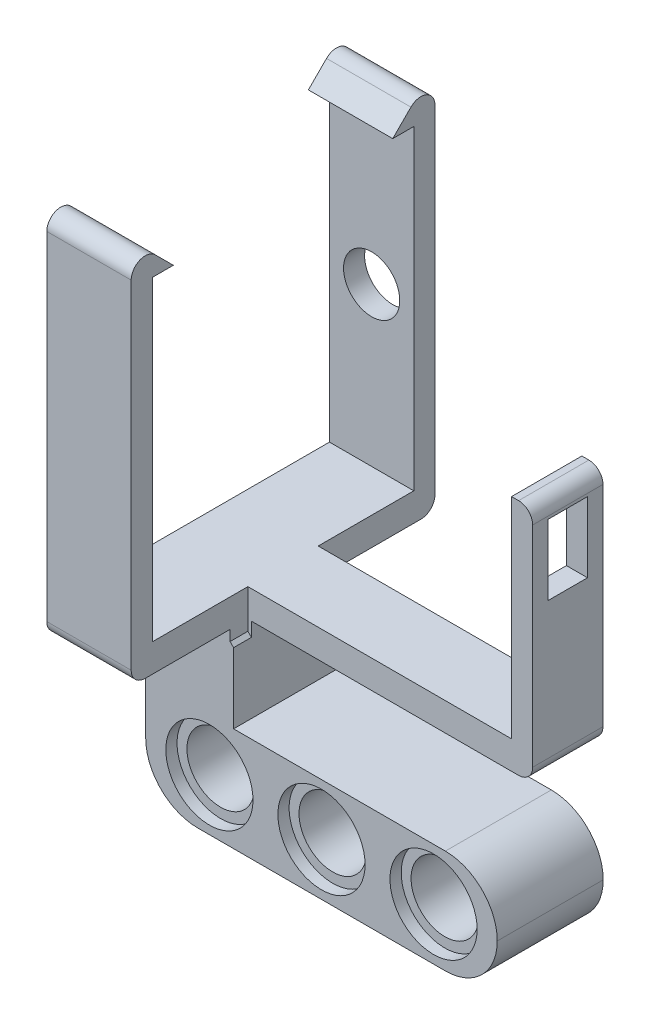
from build123d import *

# Parameters (mm, degrees)
SKETCH1_W           = 37
SKETCH1_H           = 21.6
BOSS_EXTRUDE1_DEPTH = 2
SKETCH2_W           = 6
SKETCH2_H           = 1.5
SKETCH2_W_2         = 1.5
SKETCH2_H_2         = 5
BOSS_EXTRUDE2_DEPTH = 22.44
SKETCH3_W           = 6
SKETCH3_H           = 3
BOSS_EXTRUDE3_DEPTH = 5
CHAMFER1_SIZE       = 5
SKETCH4_W           = 6
SKETCH4_H           = 3
BOSS_EXTRUDE4_DEPTH = 5
CHAMFER2_SIZE       = 5
SKETCH6_W           = 5
SKETCH6_H           = 7.52
SKETCH6_W_2         = 2.8
SKETCH6_H_2         = 5
CUT_EXTRUDE1_DEPTH  = 5
SKETCH8_W           = 20.25
SKETCH8_H           = 8.3
SKETCH8_W_2         = 10.75
SKETCH8_H_2         = 21.6
CUT_EXTRUDE3_DEPTH  = 10
FILLET1_R           = 1
FILLET2_R           = 1
SKETCH9_R           = 2
CUT_EXTRUDE4_DEPTH  = 10
SKETCH13_W          = 25
SKETCH13_H          = 7.533980582
BOSS_EXTRUDE5_DEPTH = 13.38
SKETCH14_R          = 2.4
CUT_EXTRUDE5_DEPTH  = 7.92
SKETCH15_R          = 3.1
SKETCH15_W          = 0.016515358
SKETCH15_H          = 0.077878544
CUT_EXTRUDE6_DEPTH  = 0.8
CUT_EXTRUDE7_START  = -0.8
SKETCH16_R          = 3.1
CUT_EXTRUDE7_DEPTH  = 0.8
SKETCH19_W          = 18.75
SKETCH19_H          = 6
CUT_EXTRUDE8_DEPTH  = 10
FILLET3_R           = 3.69
CHAMFER3_SIZE       = 1
CHAMFER4_SIZE       = 1


# Some blends are built 0.0001 mm under size
with BuildPart() as part:
    # Sketch1 → Boss-Extrude1 (new body)
    with BuildSketch(Plane(origin=(0, 0, 0), x_dir=(1, 0, 0), z_dir=(0, 1, 0))):
        Rectangle(SKETCH1_W, SKETCH1_H)
    extrude(amount=BOSS_EXTRUDE1_DEPTH)

    # Sketch2 → Boss-Extrude2 (add)
    with BuildSketch(Plane(origin=(0, 2, 0), x_dir=(1, 0, 0), z_dir=(0, 1, 0))):
        with Locations((-4.75, 10.05)):
            Rectangle(SKETCH2_W, SKETCH2_H)
        with Locations((-4.75, -10.05)):
            Rectangle(SKETCH2_W, SKETCH2_H)
        with Locations((17.75, 0)):
            Rectangle(SKETCH2_W_2, SKETCH2_H_2)
    extrude(amount=BOSS_EXTRUDE2_DEPTH)

    # Sketch3 → Boss-Extrude3 (add)
    with BuildSketch(Plane(origin=(0, 24.44, 0), x_dir=(1, 0, 0), z_dir=(0, 1, 0))):
        with Locations((-4.75, 9.3)):
            Rectangle(SKETCH3_W, SKETCH3_H)
    extrude(amount=BOSS_EXTRUDE3_DEPTH)

    # Chamfer1
    # the kernel refuses this chamfer: 5 mm, written as the material it takes off along each edge
    with BuildSketch(Plane(origin=(11.10841494, 29.44, -7.8), x_dir=(0, -0.9996219169112968, 0.027495876610586317), z_dir=(-1, 0, 0))) as chamfer1_piece_1:
        Polygon((CHAMFER1_SIZE * 0.999621916911, -CHAMFER1_SIZE * 0.0274958766106), (-CHAMFER1_SIZE * 0.0274958766106, -CHAMFER1_SIZE * 0.999621916911), (0, 0), align=None)
    extrude(amount=31.71682988, mode=Mode.SUBTRACT)

    # Sketch4 → Boss-Extrude4 (add)
    with BuildSketch(Plane(origin=(0, 24.44, 0), x_dir=(1, 0, 0), z_dir=(0, 1, 0))):
        with Locations((-4.75, -9.3)):
            Rectangle(SKETCH4_W, SKETCH4_H)
    extrude(amount=BOSS_EXTRUDE4_DEPTH)

    # Chamfer2
    # the kernel refuses this chamfer: 5 mm, written as the material it takes off along each edge
    with BuildSketch(Plane(origin=(11.10841494, 29.44, 7.8), x_dir=(0, -0.9996219169112968, -0.027495876610586317), z_dir=(-1, 0, 0))) as chamfer2_piece_1:
        Polygon((CHAMFER2_SIZE * 0.999621916911, CHAMFER2_SIZE * 0.0274958766106), (-CHAMFER2_SIZE * 0.0274958766106, CHAMFER2_SIZE * 0.999621916911), (0, 0), align=None)
    extrude(amount=31.71682988, mode=Mode.SUBTRACT)

    # Sketch6 → Cut-Extrude1 (cut)
    with BuildSketch(Plane(origin=(18.5, 0, 0), x_dir=(0, 0, -1), z_dir=(1, 0, 0))):
        with Locations((0, 20.68)):
            Rectangle(SKETCH6_W, SKETCH6_H)
        with Locations((0, 13.22)):
            Rectangle(SKETCH6_W_2, SKETCH6_H_2)
    extrude(amount=-CUT_EXTRUDE1_DEPTH, mode=Mode.SUBTRACT)

    # Sketch8 → Cut-Extrude3 (cut)
    with BuildSketch(Plane(origin=(0, 2, 0), x_dir=(1, 0, 0), z_dir=(0, 1, 0))):
        with Locations((8.375, 6.65)):
            Rectangle(SKETCH8_W, SKETCH8_H)
        with Locations((8.375, -6.65)):
            Rectangle(SKETCH8_W, SKETCH8_H)
        with Locations((-13.125, 0)):
            Rectangle(SKETCH8_W_2, SKETCH8_H_2)
    extrude(amount=-CUT_EXTRUDE3_DEPTH, mode=Mode.SUBTRACT)

    # Fillet1
    fillet1_edges = [part.edges().sort_by_distance(p)[0] for p in [
        (-4.75, 0, -10.8),
        (18.5, 0, 0),
        (-4.75, 0, 10.8),
        (-4.75, 27.44, -10.8),
        (-4.75, 27.44, 10.8),
    ]]
    fillet(fillet1_edges, radius=FILLET1_R)

    # Fillet2
    fillet2_edges = [part.edges().sort_by_distance(p)[0] for p in [
        (18.5, 16.92, 0),
    ]]
    fillet(fillet2_edges, radius=FILLET2_R)

    # Sketch9 → Cut-Extrude4 (cut)
    with BuildSketch(Plane.XY.offset(-9.3)):
        with Locations((-4.75, 13.22)):
            Circle(SKETCH9_R)
    extrude(amount=-CUT_EXTRUDE4_DEPTH, mode=Mode.SUBTRACT)

    # Sketch13 → Boss-Extrude5 (add)
    with BuildSketch(Plane.XZ):
        with Locations((4.75, 0)):
            Rectangle(SKETCH13_W, SKETCH13_H)
    extrude(amount=BOSS_EXTRUDE5_DEPTH)

    # Sketch14 → Cut-Extrude5 (cut)
    with BuildSketch(Plane.XY.offset(3.766990291)):
        with Locations((4.75, -9.69)):
            Circle(SKETCH14_R)
        with Locations((12.72, -9.69)):
            Circle(SKETCH14_R)
        with Locations((-3.22, -9.69)):
            Circle(SKETCH14_R)
    extrude(amount=-CUT_EXTRUDE5_DEPTH, mode=Mode.SUBTRACT)

    # Sketch15 → Cut-Extrude6 (cut)
    with BuildSketch(Plane.XY.offset(3.766990291)):
        with Locations((-3.22, -9.69)):
            Circle(SKETCH15_R)
        with Locations((4.75, -9.69)):
            Circle(SKETCH15_R)
        with Locations((12.72, -9.69)):
            Circle(SKETCH15_R)
        with Locations((1.021954756, -12.130200689)):
            Rectangle(SKETCH15_W, SKETCH15_H)
    extrude(amount=-CUT_EXTRUDE6_DEPTH, mode=Mode.SUBTRACT)

    # Sketch16 → Cut-Extrude7 (cut)
    with BuildSketch(Plane(origin=(0, 0, -3.766990291), x_dir=(-1, 0, 0), z_dir=(0, 0, -1)).offset(CUT_EXTRUDE7_START)):
        with Locations(Location((-4.75, -9.69, 0), (0, 0, 180))):
            Circle(SKETCH16_R)
        with Locations(Location((3.22, -9.69, 0), (0, 0, 180))):
            Circle(SKETCH16_R)
        with Locations(Location((-12.72, -9.69, 0), (0, 0, 180))):
            Circle(SKETCH16_R)
    extrude(amount=CUT_EXTRUDE7_DEPTH, mode=Mode.SUBTRACT)

    # Sketch19 → Cut-Extrude8 (cut)
    with BuildSketch(Plane(origin=(0, 0, -3.766990291), x_dir=(-1, 0, 0), z_dir=(0, 0, -1))):
        with Locations((-7.875, -3)):
            Rectangle(SKETCH19_W, SKETCH19_H)
    extrude(amount=-CUT_EXTRUDE8_DEPTH, mode=Mode.SUBTRACT)

    # Fillet3
    fillet3_edges = [part.edges().sort_by_distance(p)[0] for p in [
        (-7.75, -13.38, 0),
        (17.25, -13.38, 0),
        (17.25, -6, 0),
    ]]
    fillet(fillet3_edges, radius=FILLET3_R - 0.0001)  # a hair under: the kernel refuses the full size

    # Chamfer3
    # the kernel refuses this chamfer: 1 mm, written as the material it takes off along each edge
    with BuildSketch(Plane(origin=(-1.5, 0, -6.338673279), x_dir=(0.027495876610586275, -0.9996219169112968, 0), z_dir=(0, 0, 1))) as chamfer3_piece_1_section:
        Polygon((CHAMFER3_SIZE * 0.999621916911, -CHAMFER3_SIZE * 0.0274958766106), (-CHAMFER3_SIZE * 0.0274958766106, -CHAMFER3_SIZE * 0.999621916911), (0, 0), align=None)
    chamfer3_piece_1 = extrude(amount=3.838673279, mode=Mode.PRIVATE)
    chamfer3_piece_1 = split(chamfer3_piece_1, bisect_by=Plane(origin=(-1.75, -0.44047619, -3.133495146), z_dir=(1, 0, 0)), keep=Keep.TOP, mode=Mode.PRIVATE)
    add(chamfer3_piece_1, mode=Mode.SUBTRACT)

    # Chamfer4
    # the kernel refuses this chamfer: 1 mm, written as the material it takes off along each edge
    with BuildSketch(Plane(origin=(-1.5, 0, 2.5), x_dir=(-0.9996219169112968, 0.027495876610586358, 0), z_dir=(0, 0, 1))) as chamfer4_piece_1_section:
        Polygon((CHAMFER4_SIZE * 0.999621916911, CHAMFER4_SIZE * 0.0274958766106), (-CHAMFER4_SIZE * 0.0274958766106, CHAMFER4_SIZE * 0.999621916911), (0, 0), align=None)
    chamfer4_piece_1 = extrude(amount=3.838673279, mode=Mode.PRIVATE)
    chamfer4_piece_1 = split(chamfer4_piece_1, bisect_by=Plane(origin=(-1.75, -0.44047619, 3.133495146), z_dir=(1, 0, 0)), keep=Keep.TOP, mode=Mode.PRIVATE)
    add(chamfer4_piece_1, mode=Mode.SUBTRACT)


solid = part.part
